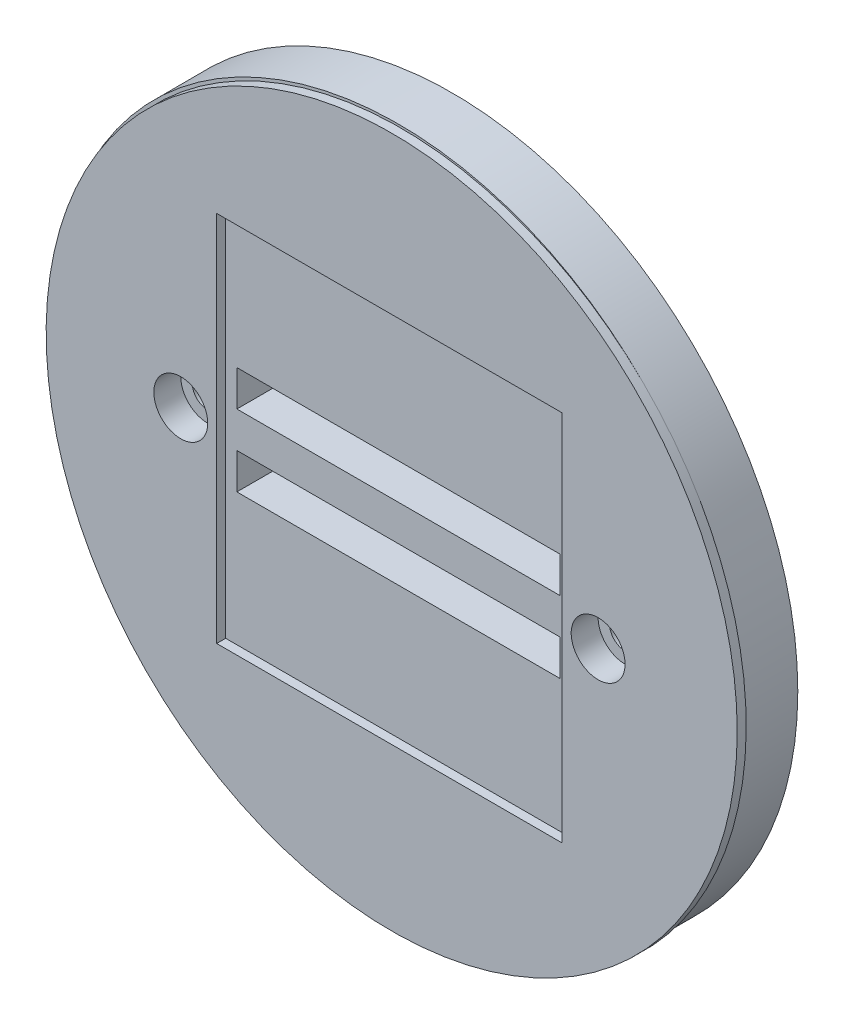
from build123d import *

# Parameters (mm, degrees)
SKETCH1_R                  = 38.5
SKETCH1_R_2                = 1.725
SKETCH1_W                  = 36
SKETCH1_H                  = 4
MAIN_FLANGE_COUPLING_DEPTH = 6
SKETCH2_R                  = 38.5
SKETCH2_R_2                = 1.5
SKETCH2_W                  = 38.5
SKETCH2_H                  = 41.5
BOSS_EXTRUDE1_DEPTH        = 1
SKETCH3_R                  = 3
CUT_EXTRUDE1_DEPTH         = 3


with BuildPart() as part:
    # Sketch1 → Main Flange Coupling (new body)
    with BuildSketch(Plane.XY):
        Circle(SKETCH1_R)
        with Locations((-23.25, 0)):
            Circle(SKETCH1_R_2, mode=Mode.SUBTRACT)
        with Locations((23.25, 0)):
            Circle(SKETCH1_R_2, mode=Mode.SUBTRACT)
        with Locations((0, 4)):
            Rectangle(SKETCH1_W, SKETCH1_H, mode=Mode.SUBTRACT)
        with Locations((0, -4)):
            Rectangle(SKETCH1_W, SKETCH1_H, mode=Mode.SUBTRACT)
    extrude(amount=-MAIN_FLANGE_COUPLING_DEPTH)

    # Sketch2 → Boss-Extrude1 (add)
    with BuildSketch(Plane.XY):
        with Locations((0.25, -0.25)):
            Circle(SKETCH2_R)
        with Locations((-23.25, 0)):
            Circle(SKETCH2_R_2, mode=Mode.SUBTRACT)
        with Locations((23.25, 0)):
            Circle(SKETCH2_R_2, mode=Mode.SUBTRACT)
        Rectangle(SKETCH2_W, SKETCH2_H, mode=Mode.SUBTRACT)
    extrude(amount=BOSS_EXTRUDE1_DEPTH)

    # Sketch3 → Cut-Extrude1 (cut)
    with BuildSketch(Plane.XY.offset(1)):
        with Locations((-23.25, 0)):
            Circle(SKETCH3_R)
        with Locations((23.25, 0)):
            Circle(SKETCH3_R)
    extrude(amount=-CUT_EXTRUDE1_DEPTH, mode=Mode.SUBTRACT)


solid = part.part
